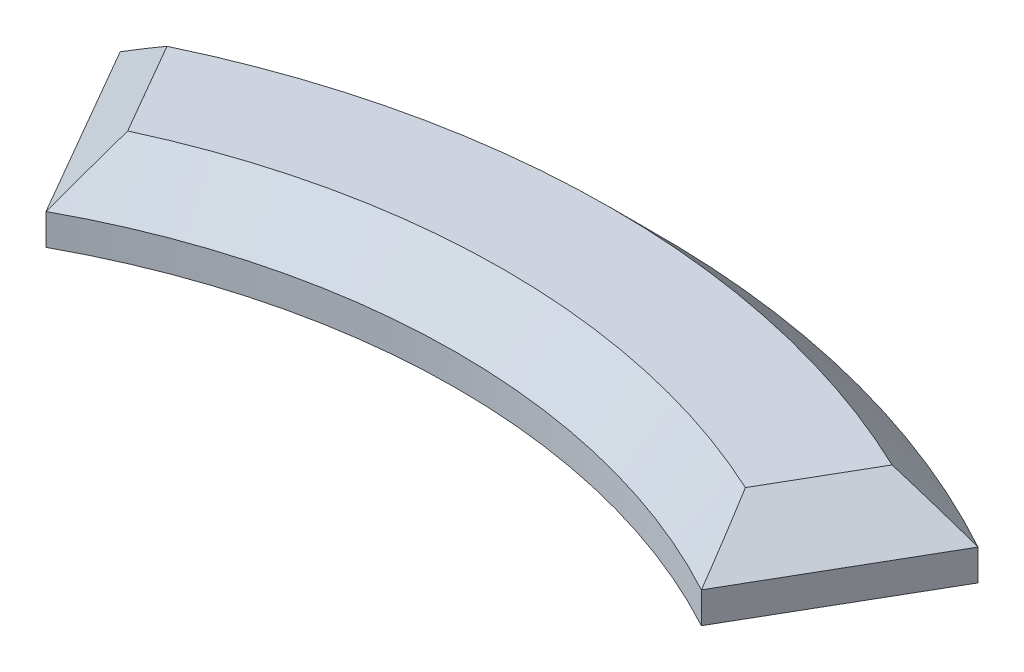
from build123d import *

# Parameters (mm, degrees)
BOSS_EXTRUDE1_DEPTH = 3.3
CHAMFER1_SIZE       = 2
SKETCH2_R           = 1.625
CUT_EXTRUDE1_DEPTH  = 2


with BuildPart() as part:
    # Sketch1 → Boss-Extrude1 (new body)
    with BuildSketch(Plane(origin=(0, 0, 0), x_dir=(1, 0, 0), z_dir=(0, 1, 0))):
        with BuildLine():
            Line((-17.971705397, 32.627906846), (-13.729256498, 25.279769804))
            ThreePointArc((-13.729256498, 25.279769804), (0, 28.767329478), (13.729256498, 25.279769804))
            Line((13.729256498, 25.279769804), (17.971705397, 32.627906846))
            ThreePointArc((17.971705397, 32.627906846), (0, 37.25), (-17.971705397, 32.627906846))
        make_face()
    extrude(amount=BOSS_EXTRUDE1_DEPTH)

    # Chamfer1
    chamfer1_edges = [part.edges().sort_by_distance(p)[0] for p in [
        (15.850480947, 3.3, -28.953838325),
        (0, 3.3, -37.25),
        (0, 3.3, -28.767329478),
        (-15.850480947, 3.3, -28.953838325),
    ]]
    chamfer(chamfer1_edges, length=CHAMFER1_SIZE)

    # Sketch2 → Cut-Extrude1 (cut)
    with BuildSketch(Plane.XZ):
        with Locations((0, -33)):
            Circle(SKETCH2_R)
    extrude(amount=-CUT_EXTRUDE1_DEPTH, mode=Mode.SUBTRACT)


solid = part.part
